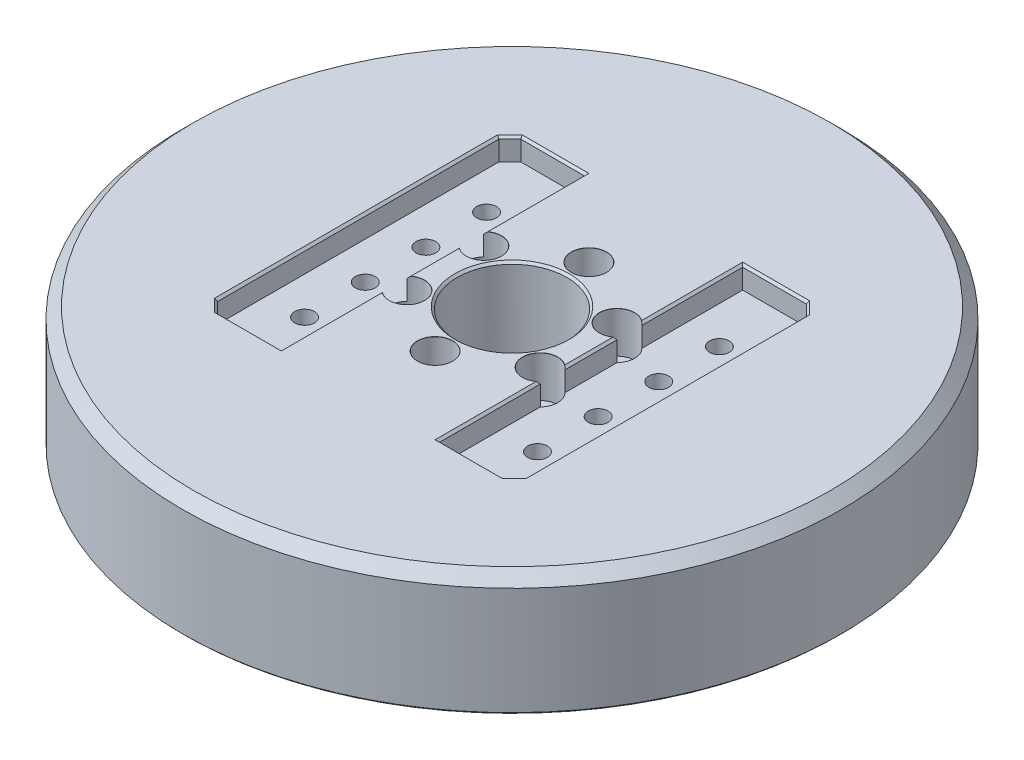
from build123d import *

# Parameters (mm, degrees)
SKETCH2_W                                           = 17
SKETCH2_H                                           = 69
CUT_EXTRUDE1_DEPTH                                  = 5
CBORE_FOR_M4_HEX_SOCKET_HEAD_CAP_SCREW1_D           = 4.5
CBORE_FOR_M4_HEX_SOCKET_HEAD_CAP_SCREW1_CBORE_D     = 8
CBORE_FOR_M4_HEX_SOCKET_HEAD_CAP_SCREW1_CBORE_DEPTH = 4.9
CBORE_FOR_M4_HEX_SOCKET_HEAD_CAP_SCR_2_COUNT        = 2
CBORE_FOR_M4_HEX_SOCKET_HEAD_CAP_SCR_2_PITCH        = 17.5
CBORE_FOR_M4_HEX_SOCKET_HEAD_CAP_SCR_3_COUNT        = 2
CBORE_FOR_M4_HEX_SOCKET_HEAD_CAP_SCR_3_PITCH        = 30.310889132
CBORE_FOR_M4_HEX_SOCKET_HEAD_CAP_SCR_4_COUNT        = 2
CBORE_FOR_M4_HEX_SOCKET_HEAD_CAP_SCR_4_PITCH        = 35
CBORE_FOR_M4_HEX_SOCKET_HEAD_CAP_SCR_5_COUNT        = 2
CBORE_FOR_M4_HEX_SOCKET_HEAD_CAP_SCR_5_PITCH        = 30.310889132
CBORE_FOR_M4_HEX_SOCKET_HEAD_CAP_SCR_6_COUNT        = 2
CBORE_FOR_M4_HEX_SOCKET_HEAD_CAP_SCR_6_PITCH        = 17.5
F_2_5MM_CHAMFER1_SIZE                               = 2.5
F_0_5MM_CHAMFER2_SIZE                               = 0.5


with BuildPart() as part:
    # Sketch1 → Revolve1 (revolve)
    with BuildSketch(Plane.XY, mode=Mode.PRIVATE) as revolve1_sk:
        Polygon((12.5, 0), (75, 0), (75, -27.5), (72.5, -27.5), (72.5, -20), (24, -20), (24, -20.5), (22.5, -20.5), (22.5, -20), (12.5, -20), align=None)
    revolve(revolve1_sk.sketch.rotate(Axis((0, 0, 0), (0, 1, 0)), 90), axis=Axis((0, 0, 0), (0, 1, 0)))

    # Sketch2 → Cut-Extrude1 (cut)
    with BuildSketch(Plane(origin=(0, 0, 0), x_dir=(1, 0, 0), z_dir=(0, 1, 0))):
        with Locations((-26.5, 0)):
            Rectangle(SKETCH2_W, SKETCH2_H)
        with Locations((26.5, 0)):
            Rectangle(SKETCH2_W, SKETCH2_H)
    extrude(amount=-CUT_EXTRUDE1_DEPTH, mode=Mode.SUBTRACT)

    # CBORE for M4 Hex Socket Head Cap Screw1 (through all)
    with Locations(Plane(origin=(0, -20.5, 0), x_dir=(-1, 0, 0), z_dir=(0, -1, 0))):
        with Locations((-26.5, 20.7), (26.5, -20.7), (26.5, -6.9), (26.5, 6.9), (26.5, 20.7), (-26.5, -20.7), (-26.5, -6.9), (-26.5, 6.9)):
            CounterBoreHole(CBORE_FOR_M4_HEX_SOCKET_HEAD_CAP_SCREW1_D / 2, CBORE_FOR_M4_HEX_SOCKET_HEAD_CAP_SCREW1_CBORE_D / 2, CBORE_FOR_M4_HEX_SOCKET_HEAD_CAP_SCREW1_CBORE_DEPTH)

    # Sketch8 → CBORE for M4 Hex Socket Head Cap Screw2 (revolve, cut)
    with BuildSketch(Plane(origin=(15.155444566, 0, 8.75), x_dir=(0, 0, 1), z_dir=(1, 0, 0))):
        Polygon((0, 0), (0, 27.5), (2.25, 27.5), (2.25, 9.4), (4, 9.4), (4, 0.025), (4.025, 0), align=None)
    cbore_for_m4_hex_socket_head_cap_screw2 = revolve(axis=Axis((15.155444566, 6.35, 8.75), (0, -1, 0)), mode=Mode.SUBTRACT)

    # CBORE for M4 Hex Socket Head Cap Scr 2: CBORE for M4 Hex Socket Head Cap Screw2 ×2
    with Locations(*[Vector(-0.8660254037844417, 0, 0.49999999999999484) * (i * CBORE_FOR_M4_HEX_SOCKET_HEAD_CAP_SCR_2_PITCH) for i in range(1, CBORE_FOR_M4_HEX_SOCKET_HEAD_CAP_SCR_2_COUNT)]):
        add(cbore_for_m4_hex_socket_head_cap_screw2, mode=Mode.SUBTRACT)

    # CBORE for M4 Hex Socket Head Cap Scr 3: CBORE for M4 Hex Socket Head Cap Screw2 ×2
    with Locations(*[(-i * CBORE_FOR_M4_HEX_SOCKET_HEAD_CAP_SCR_3_PITCH, 0, 0) for i in range(1, CBORE_FOR_M4_HEX_SOCKET_HEAD_CAP_SCR_3_COUNT)]):
        add(cbore_for_m4_hex_socket_head_cap_screw2, mode=Mode.SUBTRACT)

    # CBORE for M4 Hex Socket Head Cap Scr 4: CBORE for M4 Hex Socket Head Cap Screw2 ×2
    with Locations(*[Vector(-0.8660254037844346, 0, -0.500000000000007) * (i * CBORE_FOR_M4_HEX_SOCKET_HEAD_CAP_SCR_4_PITCH) for i in range(1, CBORE_FOR_M4_HEX_SOCKET_HEAD_CAP_SCR_4_COUNT)]):
        add(cbore_for_m4_hex_socket_head_cap_screw2, mode=Mode.SUBTRACT)

    # CBORE for M4 Hex Socket Head Cap Scr 5: CBORE for M4 Hex Socket Head Cap Screw2 ×2
    with Locations(*[Vector(-0.49999999999999195, 0, -0.8660254037844433) * (i * CBORE_FOR_M4_HEX_SOCKET_HEAD_CAP_SCR_5_PITCH) for i in range(1, CBORE_FOR_M4_HEX_SOCKET_HEAD_CAP_SCR_5_COUNT)]):
        add(cbore_for_m4_hex_socket_head_cap_screw2, mode=Mode.SUBTRACT)

    # CBORE for M4 Hex Socket Head Cap Scr 6: CBORE for M4 Hex Socket Head Cap Screw2 ×2
    with Locations(*[(0, 0, -i * CBORE_FOR_M4_HEX_SOCKET_HEAD_CAP_SCR_6_PITCH) for i in range(1, CBORE_FOR_M4_HEX_SOCKET_HEAD_CAP_SCR_6_COUNT)]):
        add(cbore_for_m4_hex_socket_head_cap_screw2, mode=Mode.SUBTRACT)

    # 2,5mm Chamfer1
    f_2_5mm_chamfer1_edges = [part.edges().sort_by_distance(p)[0] for p in [
        (0, 0, 75),
        (-35, -2.5, 34.5),
        (-35, -2.5, -34.5),
        (35, -2.5, -34.5),
        (35, -2.5, 34.5),
    ]]
    chamfer(f_2_5mm_chamfer1_edges, length=F_2_5MM_CHAMFER1_SIZE)

    # 0,5mm Chamfer2
    # the kernel refuses this chamfer: 0.5 mm, written as the material it takes off along each edge
    with BuildSketch(Plane(origin=(-18, 0, -34.5), x_dir=(0, 0.027495876610586483, -0.9996219169112968), z_dir=(-1, 0, 0))) as f_0_5mm_chamfer2_piece_1_section:
        Polygon((F_0_5MM_CHAMFER2_SIZE * 0.999621916911, F_0_5MM_CHAMFER2_SIZE * 0.0274958766106), (-F_0_5MM_CHAMFER2_SIZE * 0.0274958766106, F_0_5MM_CHAMFER2_SIZE * 0.999621916911), (0, 0), align=None)
    f_0_5mm_chamfer2_piece_1 = extrude(amount=15.785841494, mode=Mode.PRIVATE)
    f_0_5mm_chamfer2_piece_1 = split(f_0_5mm_chamfer2_piece_1, bisect_by=Plane(origin=(-28.752157989, -0.165488869, -38.247842011), z_dir=(0.7071067811865476, 0, 0.7071067811865476)), keep=Keep.TOP, mode=Mode.PRIVATE)
    add(f_0_5mm_chamfer2_piece_1, mode=Mode.SUBTRACT)
    with BuildSketch(Plane(origin=(-35.90922724, 0, -31.09077276), x_dir=(-0.7068394360706736, 0.0274958766105862, -0.7068394360706736), z_dir=(0.7071067811865476, 0, -0.7071067811865476))) as f_0_5mm_chamfer2_piece_2_section:
        Polygon((F_0_5MM_CHAMFER2_SIZE * 0.999621916911, -F_0_5MM_CHAMFER2_SIZE * 0.0274958766106), (-F_0_5MM_CHAMFER2_SIZE * 0.0274958766106, -F_0_5MM_CHAMFER2_SIZE * 0.999621916911), (0, 0), align=None)
    f_0_5mm_chamfer2_piece_2 = extrude(amount=6.107216894, mode=Mode.PRIVATE)
    f_0_5mm_chamfer2_piece_2 = split(f_0_5mm_chamfer2_piece_2, bisect_by=Plane(origin=(-33.859596112, -0.170191805, -34.5), z_dir=(0, 0, 1)), keep=Keep.TOP, mode=Mode.PRIVATE)
    f_0_5mm_chamfer2_piece_2 = split(f_0_5mm_chamfer2_piece_2, bisect_by=Plane(origin=(-35, -0.170191805, -33.359596112), z_dir=(1, 0, 0)), keep=Keep.TOP, mode=Mode.PRIVATE)
    add(f_0_5mm_chamfer2_piece_2, mode=Mode.SUBTRACT)
    with BuildSketch(Plane(origin=(0, -20, 0), x_dir=(0, 0, -1), z_dir=(1, 0, 0))) as f_0_5mm_chamfer2_piece_3:
        Polygon((12.5, F_0_5MM_CHAMFER2_SIZE), (12.5 + F_0_5MM_CHAMFER2_SIZE, 0), (12.5, 0), align=None)
    revolve(axis=Axis((0, -20, 0), (0, 1, 0)), mode=Mode.SUBTRACT)
    with BuildSketch(Plane(origin=(0, 0, 0), x_dir=(0, 0, -1), z_dir=(1, 0, 0))) as f_0_5mm_chamfer2_piece_4:
        Polygon((12.5 + F_0_5MM_CHAMFER2_SIZE, 0), (12.5, -F_0_5MM_CHAMFER2_SIZE), (12.5, 0), align=None)
    revolve(axis=Axis((0, 0, 0), (0, 1, 0)), mode=Mode.SUBTRACT)
    with BuildSketch(Plane(origin=(0, -27.5, 0), x_dir=(0, 0, -1), z_dir=(1, 0, 0))) as f_0_5mm_chamfer2_piece_5:
        Polygon((72.5 + F_0_5MM_CHAMFER2_SIZE, 0), (72.5, F_0_5MM_CHAMFER2_SIZE), (72.5, 0), align=None)
    revolve(axis=Axis((0, -27.5, 0), (0, 1, 0)), mode=Mode.SUBTRACT)
    with BuildSketch(Plane(origin=(0, -27.5, 0), x_dir=(0, 0, -1), z_dir=(1, 0, 0))) as f_0_5mm_chamfer2_piece_6:
        Polygon((75, F_0_5MM_CHAMFER2_SIZE), (75 - F_0_5MM_CHAMFER2_SIZE, 0), (75, 0), align=None)
    revolve(axis=Axis((0, -27.5, 0), (0, 1, 0)), mode=Mode.SUBTRACT)
    with BuildSketch(Plane(origin=(18, 0, -7.188188182), x_dir=(-0.9996219169112968, 0.027495876610586292, 0), z_dir=(0, 0, 1)), Plane(origin=(-18, 0, 7.188188182), x_dir=(0.9996219169112968, 0.027495876610586292, 0), z_dir=(0, 0, -1))) as f_0_5mm_chamfer2_piece_7:
        Polygon((F_0_5MM_CHAMFER2_SIZE * 0.999621916911, F_0_5MM_CHAMFER2_SIZE * 0.0274958766106), (-F_0_5MM_CHAMFER2_SIZE * 0.0274958766106, F_0_5MM_CHAMFER2_SIZE * 0.999621916911), (0, 0), align=None)
    extrude(amount=14.376376364, mode=Mode.SUBTRACT)
    with BuildSketch(Plane(origin=(18, 0, 10.311811818), x_dir=(-0.9996219169112968, 0.027495876610586292, 0), z_dir=(0, 0, 1)), Plane(origin=(18, 0, -34.5), x_dir=(-0.9996219169112968, 0.027495876610586292, 0), z_dir=(0, 0, 1)), Plane(origin=(-18, 0, 34.5), x_dir=(0.9996219169112968, 0.027495876610586292, 0), z_dir=(0, 0, -1)), Plane(origin=(-18, 0, -10.311811818), x_dir=(0.9996219169112968, 0.027495876610586292, 0), z_dir=(0, 0, -1))) as f_0_5mm_chamfer2_piece_8:
        Polygon((F_0_5MM_CHAMFER2_SIZE * 0.999621916911, F_0_5MM_CHAMFER2_SIZE * 0.0274958766106), (-F_0_5MM_CHAMFER2_SIZE * 0.0274958766106, F_0_5MM_CHAMFER2_SIZE * 0.999621916911), (0, 0), align=None)
    extrude(amount=24.188188182, mode=Mode.SUBTRACT)
    with BuildSketch(Plane(origin=(18, 0, 34.5), x_dir=(0, 0.027495876610586483, 0.9996219169112968), z_dir=(1, 0, 0))) as f_0_5mm_chamfer2_piece_9_section:
        Polygon((F_0_5MM_CHAMFER2_SIZE * 0.999621916911, F_0_5MM_CHAMFER2_SIZE * 0.0274958766106), (-F_0_5MM_CHAMFER2_SIZE * 0.0274958766106, F_0_5MM_CHAMFER2_SIZE * 0.999621916911), (0, 0), align=None)
    f_0_5mm_chamfer2_piece_9 = extrude(amount=15.785841494, mode=Mode.PRIVATE)
    f_0_5mm_chamfer2_piece_9 = split(f_0_5mm_chamfer2_piece_9, bisect_by=Plane(origin=(28.752157989, -0.165488869, 38.247842011), z_dir=(-0.7071067811865476, 0, -0.7071067811865476)), keep=Keep.TOP, mode=Mode.PRIVATE)
    add(f_0_5mm_chamfer2_piece_9, mode=Mode.SUBTRACT)
    with BuildSketch(Plane(origin=(31.59077276, 0, 35.40922724), x_dir=(0.7068394360706736, 0.0274958766105862, 0.7068394360706736), z_dir=(0.7071067811865476, 0, -0.7071067811865476))) as f_0_5mm_chamfer2_piece_10_section:
        Polygon((F_0_5MM_CHAMFER2_SIZE * 0.999621916911, F_0_5MM_CHAMFER2_SIZE * 0.0274958766106), (-F_0_5MM_CHAMFER2_SIZE * 0.0274958766106, F_0_5MM_CHAMFER2_SIZE * 0.999621916911), (0, 0), align=None)
    f_0_5mm_chamfer2_piece_10 = extrude(amount=6.107216894, mode=Mode.PRIVATE)
    f_0_5mm_chamfer2_piece_10 = split(f_0_5mm_chamfer2_piece_10, bisect_by=Plane(origin=(35, -0.170191805, 33.359596112), z_dir=(-1, 0, 0)), keep=Keep.TOP, mode=Mode.PRIVATE)
    f_0_5mm_chamfer2_piece_10 = split(f_0_5mm_chamfer2_piece_10, bisect_by=Plane(origin=(33.859596112, -0.170191805, 34.5), z_dir=(0, 0, -1)), keep=Keep.TOP, mode=Mode.PRIVATE)
    add(f_0_5mm_chamfer2_piece_10, mode=Mode.SUBTRACT)
    with BuildSketch(Plane(origin=(35, 0, 33.285841494), x_dir=(0.9996219169112968, 0.027495876610586483, 0), z_dir=(0, 0, -1))) as f_0_5mm_chamfer2_piece_11_section:
        Polygon((F_0_5MM_CHAMFER2_SIZE * 0.999621916911, F_0_5MM_CHAMFER2_SIZE * 0.0274958766106), (-F_0_5MM_CHAMFER2_SIZE * 0.0274958766106, F_0_5MM_CHAMFER2_SIZE * 0.999621916911), (0, 0), align=None)
    f_0_5mm_chamfer2_piece_11 = extrude(amount=66.571682988, mode=Mode.PRIVATE)
    f_0_5mm_chamfer2_piece_11 = split(f_0_5mm_chamfer2_piece_11, bisect_by=Plane(origin=(51.082199065, -0.165163412, 15.917800935), z_dir=(-0.7071067811865476, 0, -0.7071067811865476)), keep=Keep.TOP, mode=Mode.PRIVATE)
    f_0_5mm_chamfer2_piece_11 = split(f_0_5mm_chamfer2_piece_11, bisect_by=Plane(origin=(51.082199065, -0.165163412, -15.917800935), z_dir=(-0.7071067811865476, 0, 0.7071067811865476)), keep=Keep.TOP, mode=Mode.PRIVATE)
    add(f_0_5mm_chamfer2_piece_11, mode=Mode.SUBTRACT)
    with BuildSketch(Plane(origin=(31.59077276, 0, -35.40922724), x_dir=(0.7068394360706736, 0.0274958766105862, -0.7068394360706736), z_dir=(0.7071067811865476, 0, 0.7071067811865476))) as f_0_5mm_chamfer2_piece_12_section:
        Polygon((F_0_5MM_CHAMFER2_SIZE * 0.999621916911, -F_0_5MM_CHAMFER2_SIZE * 0.0274958766106), (-F_0_5MM_CHAMFER2_SIZE * 0.0274958766106, -F_0_5MM_CHAMFER2_SIZE * 0.999621916911), (0, 0), align=None)
    f_0_5mm_chamfer2_piece_12 = extrude(amount=6.107216894, mode=Mode.PRIVATE)
    f_0_5mm_chamfer2_piece_12 = split(f_0_5mm_chamfer2_piece_12, bisect_by=Plane(origin=(35, -0.170191805, -33.359596112), z_dir=(-1, 0, 0)), keep=Keep.TOP, mode=Mode.PRIVATE)
    f_0_5mm_chamfer2_piece_12 = split(f_0_5mm_chamfer2_piece_12, bisect_by=Plane(origin=(33.859596112, -0.170191805, -34.5), z_dir=(0, 0, 1)), keep=Keep.TOP, mode=Mode.PRIVATE)
    add(f_0_5mm_chamfer2_piece_12, mode=Mode.SUBTRACT)
    with BuildSketch(Plane(origin=(33.785841494, 0, -34.5), x_dir=(0, 0.027495876610586483, -0.9996219169112968), z_dir=(-1, 0, 0))) as f_0_5mm_chamfer2_piece_13_section:
        Polygon((F_0_5MM_CHAMFER2_SIZE * 0.999621916911, F_0_5MM_CHAMFER2_SIZE * 0.0274958766106), (-F_0_5MM_CHAMFER2_SIZE * 0.0274958766106, F_0_5MM_CHAMFER2_SIZE * 0.999621916911), (0, 0), align=None)
    f_0_5mm_chamfer2_piece_13 = extrude(amount=15.785841494, mode=Mode.PRIVATE)
    f_0_5mm_chamfer2_piece_13 = split(f_0_5mm_chamfer2_piece_13, bisect_by=Plane(origin=(28.752157989, -0.165488869, -38.247842011), z_dir=(-0.7071067811865476, 0, 0.7071067811865476)), keep=Keep.TOP, mode=Mode.PRIVATE)
    add(f_0_5mm_chamfer2_piece_13, mode=Mode.SUBTRACT)
    with BuildSketch(Plane(origin=(-33.785841494, 0, 34.5), x_dir=(0, 0.027495876610586483, 0.9996219169112968), z_dir=(1, 0, 0))) as f_0_5mm_chamfer2_piece_14_section:
        Polygon((F_0_5MM_CHAMFER2_SIZE * 0.999621916911, F_0_5MM_CHAMFER2_SIZE * 0.0274958766106), (-F_0_5MM_CHAMFER2_SIZE * 0.0274958766106, F_0_5MM_CHAMFER2_SIZE * 0.999621916911), (0, 0), align=None)
    f_0_5mm_chamfer2_piece_14 = extrude(amount=15.785841494, mode=Mode.PRIVATE)
    f_0_5mm_chamfer2_piece_14 = split(f_0_5mm_chamfer2_piece_14, bisect_by=Plane(origin=(-28.752157989, -0.165488869, 38.247842011), z_dir=(0.7071067811865476, 0, -0.7071067811865476)), keep=Keep.TOP, mode=Mode.PRIVATE)
    add(f_0_5mm_chamfer2_piece_14, mode=Mode.SUBTRACT)
    with BuildSketch(Plane(origin=(-31.59077276, 0, 35.40922724), x_dir=(-0.7068394360706736, 0.0274958766105862, 0.7068394360706736), z_dir=(-0.7071067811865476, 0, -0.7071067811865476))) as f_0_5mm_chamfer2_piece_15_section:
        Polygon((F_0_5MM_CHAMFER2_SIZE * 0.999621916911, -F_0_5MM_CHAMFER2_SIZE * 0.0274958766106), (-F_0_5MM_CHAMFER2_SIZE * 0.0274958766106, -F_0_5MM_CHAMFER2_SIZE * 0.999621916911), (0, 0), align=None)
    f_0_5mm_chamfer2_piece_15 = extrude(amount=6.107216894, mode=Mode.PRIVATE)
    f_0_5mm_chamfer2_piece_15 = split(f_0_5mm_chamfer2_piece_15, bisect_by=Plane(origin=(-35, -0.170191805, 33.359596112), z_dir=(1, 0, 0)), keep=Keep.TOP, mode=Mode.PRIVATE)
    f_0_5mm_chamfer2_piece_15 = split(f_0_5mm_chamfer2_piece_15, bisect_by=Plane(origin=(-33.859596112, -0.170191805, 34.5), z_dir=(0, 0, -1)), keep=Keep.TOP, mode=Mode.PRIVATE)
    add(f_0_5mm_chamfer2_piece_15, mode=Mode.SUBTRACT)
    with BuildSketch(Plane(origin=(-35, 0, -33.285841494), x_dir=(-0.9996219169112968, 0.027495876610586483, 0), z_dir=(0, 0, 1))) as f_0_5mm_chamfer2_piece_16_section:
        Polygon((F_0_5MM_CHAMFER2_SIZE * 0.999621916911, F_0_5MM_CHAMFER2_SIZE * 0.0274958766106), (-F_0_5MM_CHAMFER2_SIZE * 0.0274958766106, F_0_5MM_CHAMFER2_SIZE * 0.999621916911), (0, 0), align=None)
    f_0_5mm_chamfer2_piece_16 = extrude(amount=66.571682988, mode=Mode.PRIVATE)
    f_0_5mm_chamfer2_piece_16 = split(f_0_5mm_chamfer2_piece_16, bisect_by=Plane(origin=(-51.082199065, -0.165163412, -15.917800935), z_dir=(0.7071067811865476, 0, 0.7071067811865476)), keep=Keep.TOP, mode=Mode.PRIVATE)
    f_0_5mm_chamfer2_piece_16 = split(f_0_5mm_chamfer2_piece_16, bisect_by=Plane(origin=(-51.082199065, -0.165163412, 15.917800935), z_dir=(0.7071067811865476, 0, -0.7071067811865476)), keep=Keep.TOP, mode=Mode.PRIVATE)
    add(f_0_5mm_chamfer2_piece_16, mode=Mode.SUBTRACT)
    with BuildSketch(Plane(origin=(-16.714158506, 0, -34.5), x_dir=(0, 0.027495876610586483, -0.9996219169112968), z_dir=(-1, 0, 0))) as f_0_5mm_chamfer2_piece_17a_section:
        Polygon((F_0_5MM_CHAMFER2_SIZE * 0.999621916911, F_0_5MM_CHAMFER2_SIZE * 0.0274958766106), (-F_0_5MM_CHAMFER2_SIZE * 0.0274958766106, F_0_5MM_CHAMFER2_SIZE * 0.999621916911), (0, 0), align=None)
    f_0_5mm_chamfer2_piece_17a = extrude(amount=17.071682988, mode=Mode.PRIVATE)
    f_0_5mm_chamfer2_piece_17a = split(f_0_5mm_chamfer2_piece_17a, bisect_by=Plane(origin=(-18, -0.164896813, -34.664896813), z_dir=(1, 0, 0)), keep=Keep.TOP, mode=Mode.PRIVATE)
    with BuildSketch(Plane(origin=(-18, 0, -10.311811818), x_dir=(0.9996219169112968, 0.027495876610586292, 0), z_dir=(0, 0, -1))) as f_0_5mm_chamfer2_piece_17b_section:
        Polygon((F_0_5MM_CHAMFER2_SIZE * 0.999621916911, F_0_5MM_CHAMFER2_SIZE * 0.0274958766106), (-F_0_5MM_CHAMFER2_SIZE * 0.0274958766106, F_0_5MM_CHAMFER2_SIZE * 0.999621916911), (0, 0), align=None)
    f_0_5mm_chamfer2_piece_17b = extrude(amount=25.474029676, mode=Mode.PRIVATE)
    f_0_5mm_chamfer2_piece_17b = split(f_0_5mm_chamfer2_piece_17b, bisect_by=Plane(origin=(-17.835103187, -0.164896813, -34.5), z_dir=(0, 0, -1)), keep=Keep.TOP, mode=Mode.PRIVATE)
    f_0_5mm_chamfer2_piece_17 = f_0_5mm_chamfer2_piece_17a & f_0_5mm_chamfer2_piece_17b
    add(f_0_5mm_chamfer2_piece_17, mode=Mode.SUBTRACT)
    with BuildSketch(Plane(origin=(-18, 0, -34.5), x_dir=(0, 0.027495876610586483, -0.9996219169112968), z_dir=(-1, 0, 0))) as f_0_5mm_chamfer2_piece_18a_section:
        Polygon((F_0_5MM_CHAMFER2_SIZE * 0.999621916911, F_0_5MM_CHAMFER2_SIZE * 0.0274958766106), (-F_0_5MM_CHAMFER2_SIZE * 0.0274958766106, F_0_5MM_CHAMFER2_SIZE * 0.999621916911), (0, 0), align=None)
    f_0_5mm_chamfer2_piece_18a = extrude(amount=15.785841494, mode=Mode.PRIVATE)
    f_0_5mm_chamfer2_piece_18a = split(f_0_5mm_chamfer2_piece_18a, bisect_by=Plane(origin=(-32.689580407, -0.159046562, -34.310419593), z_dir=(-0.7071067811865476, 0, -0.7071067811865476)), keep=Keep.TOP, mode=Mode.PRIVATE)
    with BuildSketch(Plane(origin=(-35.90922724, 0, -31.09077276), x_dir=(-0.7068394360706736, 0.0274958766105862, -0.7068394360706736), z_dir=(0.7071067811865476, 0, -0.7071067811865476))) as f_0_5mm_chamfer2_piece_18b_section:
        Polygon((F_0_5MM_CHAMFER2_SIZE * 0.999621916911, -F_0_5MM_CHAMFER2_SIZE * 0.0274958766106), (-F_0_5MM_CHAMFER2_SIZE * 0.0274958766106, -F_0_5MM_CHAMFER2_SIZE * 0.999621916911), (0, 0), align=None)
    f_0_5mm_chamfer2_piece_18b = extrude(amount=6.107216894, mode=Mode.PRIVATE)
    f_0_5mm_chamfer2_piece_18b = split(f_0_5mm_chamfer2_piece_18b, bisect_by=Plane(origin=(-32.231892818, -0.159046562, -34.5), z_dir=(0, 0, -1)), keep=Keep.TOP, mode=Mode.PRIVATE)
    f_0_5mm_chamfer2_piece_18 = f_0_5mm_chamfer2_piece_18a & f_0_5mm_chamfer2_piece_18b
    add(f_0_5mm_chamfer2_piece_18, mode=Mode.SUBTRACT)
    with BuildSketch(Plane(origin=(-35.90922724, 0, -31.09077276), x_dir=(-0.7068394360706736, 0.0274958766105862, -0.7068394360706736), z_dir=(0.7071067811865476, 0, -0.7071067811865476))) as f_0_5mm_chamfer2_piece_19a_section:
        Polygon((F_0_5MM_CHAMFER2_SIZE * 0.999621916911, -F_0_5MM_CHAMFER2_SIZE * 0.0274958766106), (-F_0_5MM_CHAMFER2_SIZE * 0.0274958766106, -F_0_5MM_CHAMFER2_SIZE * 0.999621916911), (0, 0), align=None)
    f_0_5mm_chamfer2_piece_19a = extrude(amount=6.107216894, mode=Mode.PRIVATE)
    f_0_5mm_chamfer2_piece_19a = split(f_0_5mm_chamfer2_piece_19a, bisect_by=Plane(origin=(-35, -0.159046562, -31.731892818), z_dir=(-1, 0, 0)), keep=Keep.TOP, mode=Mode.PRIVATE)
    with BuildSketch(Plane(origin=(-35, 0, -33.285841494), x_dir=(-0.9996219169112968, 0.027495876610586483, 0), z_dir=(0, 0, 1))) as f_0_5mm_chamfer2_piece_19b_section:
        Polygon((F_0_5MM_CHAMFER2_SIZE * 0.999621916911, F_0_5MM_CHAMFER2_SIZE * 0.0274958766106), (-F_0_5MM_CHAMFER2_SIZE * 0.0274958766106, F_0_5MM_CHAMFER2_SIZE * 0.999621916911), (0, 0), align=None)
    f_0_5mm_chamfer2_piece_19b = extrude(amount=66.571682988, mode=Mode.PRIVATE)
    f_0_5mm_chamfer2_piece_19b = split(f_0_5mm_chamfer2_piece_19b, bisect_by=Plane(origin=(-34.810419593, -0.159046562, -32.189580407), z_dir=(-0.7071067811865476, 0, -0.7071067811865476)), keep=Keep.TOP, mode=Mode.PRIVATE)
    f_0_5mm_chamfer2_piece_19 = f_0_5mm_chamfer2_piece_19a & f_0_5mm_chamfer2_piece_19b
    add(f_0_5mm_chamfer2_piece_19, mode=Mode.SUBTRACT)
    with BuildSketch(Plane(origin=(16.714158506, 0, 34.5), x_dir=(0, 0.027495876610586483, 0.9996219169112968), z_dir=(1, 0, 0))) as f_0_5mm_chamfer2_piece_20a_section:
        Polygon((F_0_5MM_CHAMFER2_SIZE * 0.999621916911, F_0_5MM_CHAMFER2_SIZE * 0.0274958766106), (-F_0_5MM_CHAMFER2_SIZE * 0.0274958766106, F_0_5MM_CHAMFER2_SIZE * 0.999621916911), (0, 0), align=None)
    f_0_5mm_chamfer2_piece_20a = extrude(amount=17.071682988, mode=Mode.PRIVATE)
    f_0_5mm_chamfer2_piece_20a = split(f_0_5mm_chamfer2_piece_20a, bisect_by=Plane(origin=(18, -0.164896813, 34.664896813), z_dir=(-1, 0, 0)), keep=Keep.TOP, mode=Mode.PRIVATE)
    with BuildSketch(Plane(origin=(18, 0, 10.311811818), x_dir=(-0.9996219169112968, 0.027495876610586292, 0), z_dir=(0, 0, 1))) as f_0_5mm_chamfer2_piece_20b_section:
        Polygon((F_0_5MM_CHAMFER2_SIZE * 0.999621916911, F_0_5MM_CHAMFER2_SIZE * 0.0274958766106), (-F_0_5MM_CHAMFER2_SIZE * 0.0274958766106, F_0_5MM_CHAMFER2_SIZE * 0.999621916911), (0, 0), align=None)
    f_0_5mm_chamfer2_piece_20b = extrude(amount=25.474029676, mode=Mode.PRIVATE)
    f_0_5mm_chamfer2_piece_20b = split(f_0_5mm_chamfer2_piece_20b, bisect_by=Plane(origin=(17.835103187, -0.164896813, 34.5), z_dir=(0, 0, 1)), keep=Keep.TOP, mode=Mode.PRIVATE)
    f_0_5mm_chamfer2_piece_20 = f_0_5mm_chamfer2_piece_20a & f_0_5mm_chamfer2_piece_20b
    add(f_0_5mm_chamfer2_piece_20, mode=Mode.SUBTRACT)
    with BuildSketch(Plane(origin=(31.59077276, 0, 35.40922724), x_dir=(0.7068394360706736, 0.0274958766105862, 0.7068394360706736), z_dir=(0.7071067811865476, 0, -0.7071067811865476))) as f_0_5mm_chamfer2_piece_21a_section:
        Polygon((F_0_5MM_CHAMFER2_SIZE * 0.999621916911, F_0_5MM_CHAMFER2_SIZE * 0.0274958766106), (-F_0_5MM_CHAMFER2_SIZE * 0.0274958766106, F_0_5MM_CHAMFER2_SIZE * 0.999621916911), (0, 0), align=None)
    f_0_5mm_chamfer2_piece_21a = extrude(amount=6.107216894, mode=Mode.PRIVATE)
    f_0_5mm_chamfer2_piece_21a = split(f_0_5mm_chamfer2_piece_21a, bisect_by=Plane(origin=(32.231892818, -0.159046562, 34.5), z_dir=(0, 0, 1)), keep=Keep.TOP, mode=Mode.PRIVATE)
    with BuildSketch(Plane(origin=(18, 0, 34.5), x_dir=(0, 0.027495876610586483, 0.9996219169112968), z_dir=(1, 0, 0))) as f_0_5mm_chamfer2_piece_21b_section:
        Polygon((F_0_5MM_CHAMFER2_SIZE * 0.999621916911, F_0_5MM_CHAMFER2_SIZE * 0.0274958766106), (-F_0_5MM_CHAMFER2_SIZE * 0.0274958766106, F_0_5MM_CHAMFER2_SIZE * 0.999621916911), (0, 0), align=None)
    f_0_5mm_chamfer2_piece_21b = extrude(amount=15.785841494, mode=Mode.PRIVATE)
    f_0_5mm_chamfer2_piece_21b = split(f_0_5mm_chamfer2_piece_21b, bisect_by=Plane(origin=(32.689580407, -0.159046562, 34.310419593), z_dir=(0.7071067811865476, 0, 0.7071067811865476)), keep=Keep.TOP, mode=Mode.PRIVATE)
    f_0_5mm_chamfer2_piece_21 = f_0_5mm_chamfer2_piece_21a & f_0_5mm_chamfer2_piece_21b
    add(f_0_5mm_chamfer2_piece_21, mode=Mode.SUBTRACT)
    with BuildSketch(Plane(origin=(35, 0, 33.285841494), x_dir=(0.9996219169112968, 0.027495876610586483, 0), z_dir=(0, 0, -1))) as f_0_5mm_chamfer2_piece_22a_section:
        Polygon((F_0_5MM_CHAMFER2_SIZE * 0.999621916911, F_0_5MM_CHAMFER2_SIZE * 0.0274958766106), (-F_0_5MM_CHAMFER2_SIZE * 0.0274958766106, F_0_5MM_CHAMFER2_SIZE * 0.999621916911), (0, 0), align=None)
    f_0_5mm_chamfer2_piece_22a = extrude(amount=66.571682988, mode=Mode.PRIVATE)
    f_0_5mm_chamfer2_piece_22a = split(f_0_5mm_chamfer2_piece_22a, bisect_by=Plane(origin=(34.810419593, -0.159046562, 32.189580407), z_dir=(0.7071067811865476, 0, 0.7071067811865476)), keep=Keep.TOP, mode=Mode.PRIVATE)
    with BuildSketch(Plane(origin=(31.59077276, 0, 35.40922724), x_dir=(0.7068394360706736, 0.0274958766105862, 0.7068394360706736), z_dir=(0.7071067811865476, 0, -0.7071067811865476))) as f_0_5mm_chamfer2_piece_22b_section:
        Polygon((F_0_5MM_CHAMFER2_SIZE * 0.999621916911, F_0_5MM_CHAMFER2_SIZE * 0.0274958766106), (-F_0_5MM_CHAMFER2_SIZE * 0.0274958766106, F_0_5MM_CHAMFER2_SIZE * 0.999621916911), (0, 0), align=None)
    f_0_5mm_chamfer2_piece_22b = extrude(amount=6.107216894, mode=Mode.PRIVATE)
    f_0_5mm_chamfer2_piece_22b = split(f_0_5mm_chamfer2_piece_22b, bisect_by=Plane(origin=(35, -0.159046562, 31.731892818), z_dir=(1, 0, 0)), keep=Keep.TOP, mode=Mode.PRIVATE)
    f_0_5mm_chamfer2_piece_22 = f_0_5mm_chamfer2_piece_22a & f_0_5mm_chamfer2_piece_22b
    add(f_0_5mm_chamfer2_piece_22, mode=Mode.SUBTRACT)
    with BuildSketch(Plane(origin=(35, 0, 33.285841494), x_dir=(0.9996219169112968, 0.027495876610586483, 0), z_dir=(0, 0, -1))) as f_0_5mm_chamfer2_piece_23a_section:
        Polygon((F_0_5MM_CHAMFER2_SIZE * 0.999621916911, F_0_5MM_CHAMFER2_SIZE * 0.0274958766106), (-F_0_5MM_CHAMFER2_SIZE * 0.0274958766106, F_0_5MM_CHAMFER2_SIZE * 0.999621916911), (0, 0), align=None)
    f_0_5mm_chamfer2_piece_23a = extrude(amount=66.571682988, mode=Mode.PRIVATE)
    f_0_5mm_chamfer2_piece_23a = split(f_0_5mm_chamfer2_piece_23a, bisect_by=Plane(origin=(34.810419593, -0.159046562, -32.189580407), z_dir=(0.7071067811865476, 0, -0.7071067811865476)), keep=Keep.TOP, mode=Mode.PRIVATE)
    with BuildSketch(Plane(origin=(31.59077276, 0, -35.40922724), x_dir=(0.7068394360706736, 0.0274958766105862, -0.7068394360706736), z_dir=(0.7071067811865476, 0, 0.7071067811865476))) as f_0_5mm_chamfer2_piece_23b_section:
        Polygon((F_0_5MM_CHAMFER2_SIZE * 0.999621916911, -F_0_5MM_CHAMFER2_SIZE * 0.0274958766106), (-F_0_5MM_CHAMFER2_SIZE * 0.0274958766106, -F_0_5MM_CHAMFER2_SIZE * 0.999621916911), (0, 0), align=None)
    f_0_5mm_chamfer2_piece_23b = extrude(amount=6.107216894, mode=Mode.PRIVATE)
    f_0_5mm_chamfer2_piece_23b = split(f_0_5mm_chamfer2_piece_23b, bisect_by=Plane(origin=(35, -0.159046562, -31.731892818), z_dir=(1, 0, 0)), keep=Keep.TOP, mode=Mode.PRIVATE)
    f_0_5mm_chamfer2_piece_23 = f_0_5mm_chamfer2_piece_23a & f_0_5mm_chamfer2_piece_23b
    add(f_0_5mm_chamfer2_piece_23, mode=Mode.SUBTRACT)
    with BuildSketch(Plane(origin=(33.785841494, 0, -34.5), x_dir=(0, 0.027495876610586483, -0.9996219169112968), z_dir=(-1, 0, 0))) as f_0_5mm_chamfer2_piece_24a_section:
        Polygon((F_0_5MM_CHAMFER2_SIZE * 0.999621916911, F_0_5MM_CHAMFER2_SIZE * 0.0274958766106), (-F_0_5MM_CHAMFER2_SIZE * 0.0274958766106, F_0_5MM_CHAMFER2_SIZE * 0.999621916911), (0, 0), align=None)
    f_0_5mm_chamfer2_piece_24a = extrude(amount=17.071682988, mode=Mode.PRIVATE)
    f_0_5mm_chamfer2_piece_24a = split(f_0_5mm_chamfer2_piece_24a, bisect_by=Plane(origin=(18, -0.164896813, -34.664896813), z_dir=(-1, 0, 0)), keep=Keep.TOP, mode=Mode.PRIVATE)
    with BuildSketch(Plane(origin=(18, 0, -35.785841494), x_dir=(-0.9996219169112968, 0.027495876610586292, 0), z_dir=(0, 0, 1))) as f_0_5mm_chamfer2_piece_24b_section:
        Polygon((F_0_5MM_CHAMFER2_SIZE * 0.999621916911, F_0_5MM_CHAMFER2_SIZE * 0.0274958766106), (-F_0_5MM_CHAMFER2_SIZE * 0.0274958766106, F_0_5MM_CHAMFER2_SIZE * 0.999621916911), (0, 0), align=None)
    f_0_5mm_chamfer2_piece_24b = extrude(amount=25.474029676, mode=Mode.PRIVATE)
    f_0_5mm_chamfer2_piece_24b = split(f_0_5mm_chamfer2_piece_24b, bisect_by=Plane(origin=(17.835103187, -0.164896813, -34.5), z_dir=(0, 0, -1)), keep=Keep.TOP, mode=Mode.PRIVATE)
    f_0_5mm_chamfer2_piece_24 = f_0_5mm_chamfer2_piece_24a & f_0_5mm_chamfer2_piece_24b
    add(f_0_5mm_chamfer2_piece_24, mode=Mode.SUBTRACT)
    with BuildSketch(Plane(origin=(31.59077276, 0, -35.40922724), x_dir=(0.7068394360706736, 0.0274958766105862, -0.7068394360706736), z_dir=(0.7071067811865476, 0, 0.7071067811865476))) as f_0_5mm_chamfer2_piece_25a_section:
        Polygon((F_0_5MM_CHAMFER2_SIZE * 0.999621916911, -F_0_5MM_CHAMFER2_SIZE * 0.0274958766106), (-F_0_5MM_CHAMFER2_SIZE * 0.0274958766106, -F_0_5MM_CHAMFER2_SIZE * 0.999621916911), (0, 0), align=None)
    f_0_5mm_chamfer2_piece_25a = extrude(amount=6.107216894, mode=Mode.PRIVATE)
    f_0_5mm_chamfer2_piece_25a = split(f_0_5mm_chamfer2_piece_25a, bisect_by=Plane(origin=(32.231892818, -0.159046562, -34.5), z_dir=(0, 0, -1)), keep=Keep.TOP, mode=Mode.PRIVATE)
    with BuildSketch(Plane(origin=(33.785841494, 0, -34.5), x_dir=(0, 0.027495876610586483, -0.9996219169112968), z_dir=(-1, 0, 0))) as f_0_5mm_chamfer2_piece_25b_section:
        Polygon((F_0_5MM_CHAMFER2_SIZE * 0.999621916911, F_0_5MM_CHAMFER2_SIZE * 0.0274958766106), (-F_0_5MM_CHAMFER2_SIZE * 0.0274958766106, F_0_5MM_CHAMFER2_SIZE * 0.999621916911), (0, 0), align=None)
    f_0_5mm_chamfer2_piece_25b = extrude(amount=15.785841494, mode=Mode.PRIVATE)
    f_0_5mm_chamfer2_piece_25b = split(f_0_5mm_chamfer2_piece_25b, bisect_by=Plane(origin=(32.689580407, -0.159046562, -34.310419593), z_dir=(0.7071067811865476, 0, -0.7071067811865476)), keep=Keep.TOP, mode=Mode.PRIVATE)
    f_0_5mm_chamfer2_piece_25 = f_0_5mm_chamfer2_piece_25a & f_0_5mm_chamfer2_piece_25b
    add(f_0_5mm_chamfer2_piece_25, mode=Mode.SUBTRACT)
    with BuildSketch(Plane(origin=(-33.785841494, 0, 34.5), x_dir=(0, 0.027495876610586483, 0.9996219169112968), z_dir=(1, 0, 0))) as f_0_5mm_chamfer2_piece_26a_section:
        Polygon((F_0_5MM_CHAMFER2_SIZE * 0.999621916911, F_0_5MM_CHAMFER2_SIZE * 0.0274958766106), (-F_0_5MM_CHAMFER2_SIZE * 0.0274958766106, F_0_5MM_CHAMFER2_SIZE * 0.999621916911), (0, 0), align=None)
    f_0_5mm_chamfer2_piece_26a = extrude(amount=17.071682988, mode=Mode.PRIVATE)
    f_0_5mm_chamfer2_piece_26a = split(f_0_5mm_chamfer2_piece_26a, bisect_by=Plane(origin=(-18, -0.164896813, 34.664896813), z_dir=(1, 0, 0)), keep=Keep.TOP, mode=Mode.PRIVATE)
    with BuildSketch(Plane(origin=(-18, 0, 35.785841494), x_dir=(0.9996219169112968, 0.027495876610586292, 0), z_dir=(0, 0, -1))) as f_0_5mm_chamfer2_piece_26b_section:
        Polygon((F_0_5MM_CHAMFER2_SIZE * 0.999621916911, F_0_5MM_CHAMFER2_SIZE * 0.0274958766106), (-F_0_5MM_CHAMFER2_SIZE * 0.0274958766106, F_0_5MM_CHAMFER2_SIZE * 0.999621916911), (0, 0), align=None)
    f_0_5mm_chamfer2_piece_26b = extrude(amount=25.474029676, mode=Mode.PRIVATE)
    f_0_5mm_chamfer2_piece_26b = split(f_0_5mm_chamfer2_piece_26b, bisect_by=Plane(origin=(-17.835103187, -0.164896813, 34.5), z_dir=(0, 0, 1)), keep=Keep.TOP, mode=Mode.PRIVATE)
    f_0_5mm_chamfer2_piece_26 = f_0_5mm_chamfer2_piece_26a & f_0_5mm_chamfer2_piece_26b
    add(f_0_5mm_chamfer2_piece_26, mode=Mode.SUBTRACT)
    with BuildSketch(Plane(origin=(-31.59077276, 0, 35.40922724), x_dir=(-0.7068394360706736, 0.0274958766105862, 0.7068394360706736), z_dir=(-0.7071067811865476, 0, -0.7071067811865476))) as f_0_5mm_chamfer2_piece_27a_section:
        Polygon((F_0_5MM_CHAMFER2_SIZE * 0.999621916911, -F_0_5MM_CHAMFER2_SIZE * 0.0274958766106), (-F_0_5MM_CHAMFER2_SIZE * 0.0274958766106, -F_0_5MM_CHAMFER2_SIZE * 0.999621916911), (0, 0), align=None)
    f_0_5mm_chamfer2_piece_27a = extrude(amount=6.107216894, mode=Mode.PRIVATE)
    f_0_5mm_chamfer2_piece_27a = split(f_0_5mm_chamfer2_piece_27a, bisect_by=Plane(origin=(-32.231892818, -0.159046562, 34.5), z_dir=(0, 0, 1)), keep=Keep.TOP, mode=Mode.PRIVATE)
    with BuildSketch(Plane(origin=(-33.785841494, 0, 34.5), x_dir=(0, 0.027495876610586483, 0.9996219169112968), z_dir=(1, 0, 0))) as f_0_5mm_chamfer2_piece_27b_section:
        Polygon((F_0_5MM_CHAMFER2_SIZE * 0.999621916911, F_0_5MM_CHAMFER2_SIZE * 0.0274958766106), (-F_0_5MM_CHAMFER2_SIZE * 0.0274958766106, F_0_5MM_CHAMFER2_SIZE * 0.999621916911), (0, 0), align=None)
    f_0_5mm_chamfer2_piece_27b = extrude(amount=15.785841494, mode=Mode.PRIVATE)
    f_0_5mm_chamfer2_piece_27b = split(f_0_5mm_chamfer2_piece_27b, bisect_by=Plane(origin=(-32.689580407, -0.159046562, 34.310419593), z_dir=(-0.7071067811865476, 0, 0.7071067811865476)), keep=Keep.TOP, mode=Mode.PRIVATE)
    f_0_5mm_chamfer2_piece_27 = f_0_5mm_chamfer2_piece_27a & f_0_5mm_chamfer2_piece_27b
    add(f_0_5mm_chamfer2_piece_27, mode=Mode.SUBTRACT)
    with BuildSketch(Plane(origin=(-35, 0, -33.285841494), x_dir=(-0.9996219169112968, 0.027495876610586483, 0), z_dir=(0, 0, 1))) as f_0_5mm_chamfer2_piece_28a_section:
        Polygon((F_0_5MM_CHAMFER2_SIZE * 0.999621916911, F_0_5MM_CHAMFER2_SIZE * 0.0274958766106), (-F_0_5MM_CHAMFER2_SIZE * 0.0274958766106, F_0_5MM_CHAMFER2_SIZE * 0.999621916911), (0, 0), align=None)
    f_0_5mm_chamfer2_piece_28a = extrude(amount=66.571682988, mode=Mode.PRIVATE)
    f_0_5mm_chamfer2_piece_28a = split(f_0_5mm_chamfer2_piece_28a, bisect_by=Plane(origin=(-34.810419593, -0.159046562, 32.189580407), z_dir=(-0.7071067811865476, 0, 0.7071067811865476)), keep=Keep.TOP, mode=Mode.PRIVATE)
    with BuildSketch(Plane(origin=(-31.59077276, 0, 35.40922724), x_dir=(-0.7068394360706736, 0.0274958766105862, 0.7068394360706736), z_dir=(-0.7071067811865476, 0, -0.7071067811865476))) as f_0_5mm_chamfer2_piece_28b_section:
        Polygon((F_0_5MM_CHAMFER2_SIZE * 0.999621916911, -F_0_5MM_CHAMFER2_SIZE * 0.0274958766106), (-F_0_5MM_CHAMFER2_SIZE * 0.0274958766106, -F_0_5MM_CHAMFER2_SIZE * 0.999621916911), (0, 0), align=None)
    f_0_5mm_chamfer2_piece_28b = extrude(amount=6.107216894, mode=Mode.PRIVATE)
    f_0_5mm_chamfer2_piece_28b = split(f_0_5mm_chamfer2_piece_28b, bisect_by=Plane(origin=(-35, -0.159046562, 31.731892818), z_dir=(-1, 0, 0)), keep=Keep.TOP, mode=Mode.PRIVATE)
    f_0_5mm_chamfer2_piece_28 = f_0_5mm_chamfer2_piece_28a & f_0_5mm_chamfer2_piece_28b
    add(f_0_5mm_chamfer2_piece_28, mode=Mode.SUBTRACT)


solid = part.part
